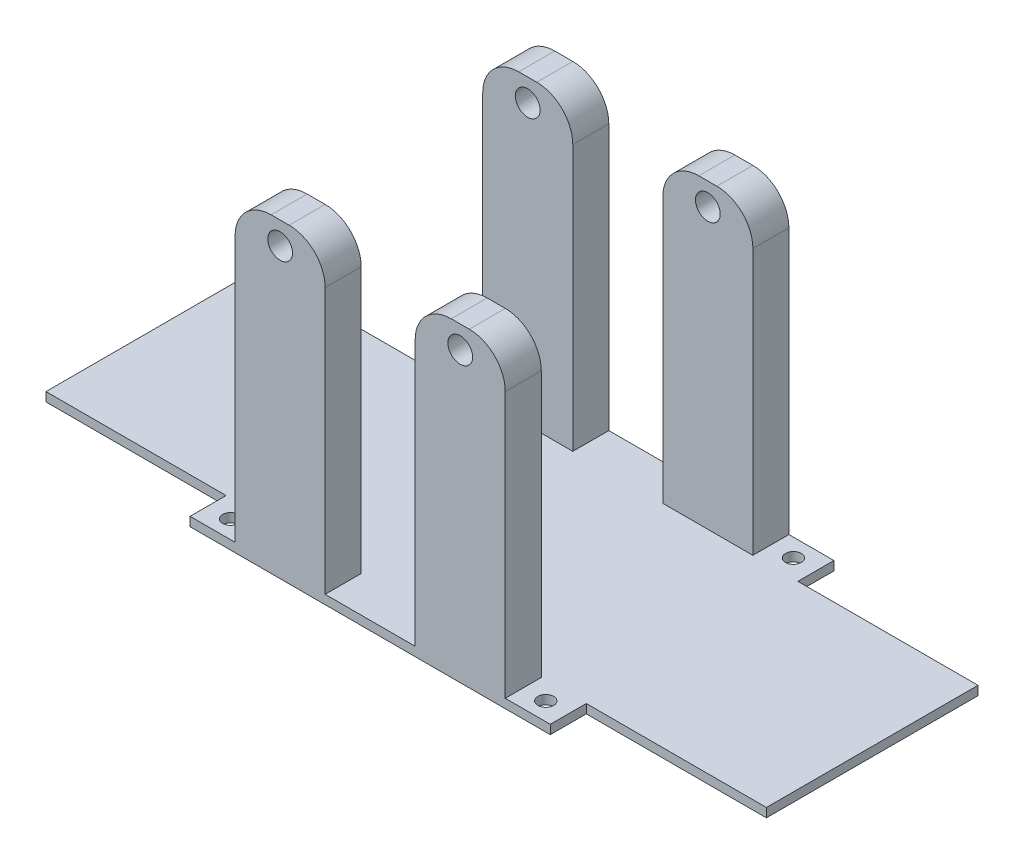
from build123d import *

# Parameters (mm, degrees)
SKETCH_1_R               = 1.75
EXTRUDE_1_DEPTH          = 2
SKETCH_2_W               = 20
SKETCH_2_H               = 8
EXTRUDE_2_DEPTH          = 67
CUT_EXTRUDE_1_DEPTH      = 124.004064973
CUT_EXTRUDE_1_DEPTH_BACK = 124.004064973
SKETCH_3_R               = 2.75
FILLET_1_R               = 8


with BuildPart() as part:
    # Эскиз1 → Бобышка-Вытянуть1 (new body)
    with BuildSketch(Plane(origin=(0, 0, 0), x_dir=(1, 0, 0), z_dir=(0, 1, 0))):
        Polygon((-80, -23.5), (-40, -23.5), (-40, -31.5), (40, -31.5), (40, -23.5), (80, -23.5), (80, 23.5), (40, 23.5), (40, 31.5), (-40, 31.5), (-40, 23.5), (-80, 23.5), align=None)
        with Locations((-35, 27.5)):
            Circle(SKETCH_1_R, mode=Mode.SUBTRACT)
        with Locations((35, 27.5)):
            Circle(SKETCH_1_R, mode=Mode.SUBTRACT)
        with Locations((35, -27.5)):
            Circle(SKETCH_1_R, mode=Mode.SUBTRACT)
        with Locations((-35, -27.5)):
            Circle(SKETCH_1_R, mode=Mode.SUBTRACT)
    extrude(amount=EXTRUDE_1_DEPTH)

    # Эскиз2 → Бобышка-Вытянуть2 (add)
    with BuildSketch(Plane(origin=(0, 2, 0), x_dir=(1, 0, 0), z_dir=(0, 1, 0))):
        with Locations((20, -27.5)):
            Rectangle(SKETCH_2_W, SKETCH_2_H)
        with Locations((-20, -27.5)):
            Rectangle(SKETCH_2_W, SKETCH_2_H)
        with Locations((20, 27.5)):
            Rectangle(SKETCH_2_W, SKETCH_2_H)
        with Locations((-20, 27.5)):
            Rectangle(SKETCH_2_W, SKETCH_2_H)
    extrude(amount=EXTRUDE_2_DEPTH)

    # Эскиз3 → Вырез-Вытянуть1 (cut, two sides: drawn at the far end of the back side and taken through both)
    with BuildSketch(Plane.XY.offset(31.5).offset(-CUT_EXTRUDE_1_DEPTH_BACK)):
        with Locations((-20, 64)):
            Circle(SKETCH_3_R)
        with Locations((20, 64)):
            Circle(SKETCH_3_R)
    extrude(amount=CUT_EXTRUDE_1_DEPTH + CUT_EXTRUDE_1_DEPTH_BACK, mode=Mode.SUBTRACT)

    # Скругление1
    fillet_1_edges = [part.edges().sort_by_distance(p)[0] for p in [
        (30, 69, -27.5),
        (10, 69, -27.5),
        (-30, 69, -27.5),
        (-30, 69, 27.5),
        (10, 69, 27.5),
        (30, 69, 27.5),
        (-10, 69, -27.5),
        (-10, 69, 27.5),
    ]]
    fillet(fillet_1_edges, radius=FILLET_1_R)


solid = part.part
